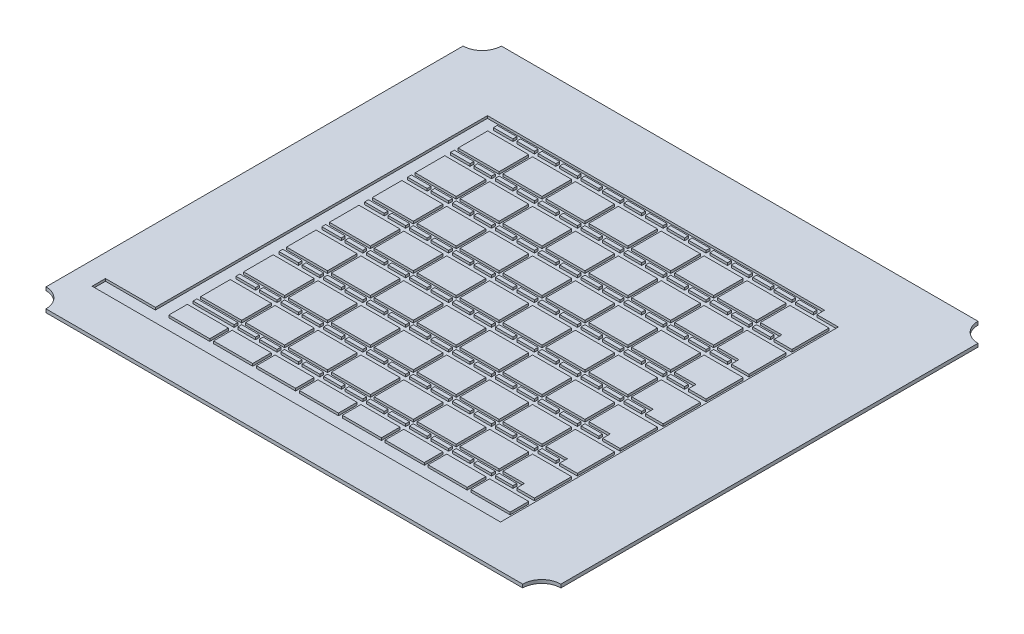
from build123d import *

# Parameters (mm, degrees)
SKETCH1_W           = 685.8
SKETCH1_H           = 606.425
BOSS_EXTRUDE1_DEPTH = 4.4958
SKETCH3_W           = 54.61
SKETCH3_H           = 24.765
SKETCH3_H_2         = 39.37
SKETCH3_W_2         = 26.035
SKETCH3_H_3         = 5.08
SKETCH3_W_3         = 23.495
SKETCH3_W_4         = 52.07
CUT_EXTRUDE1_DEPTH  = 3.175
CUT_EXTRUDE2_DEPTH  = 458.753691819


with BuildPart() as part:
    # Sketch1 → Boss-Extrude1 (new body)
    with BuildSketch(Plane(origin=(0, 0, 0), x_dir=(1, 0, 0), z_dir=(0, 1, 0))):
        Rectangle(SKETCH1_W, SKETCH1_H)
    extrude(amount=BOSS_EXTRUDE1_DEPTH)

    # Sketch3 → Cut-Extrude1 (cut)
    with BuildSketch(Plane(origin=(0, 4.4958, 0), x_dir=(1, 0, 0), z_dir=(0, 1, 0))):
        Polygon((-246.407774439, 213.72946466), (-246.407774439, -228.6), (-312.907002617, -228.6), (-312.907002617, -246.38), (231.14, -246.38), (231.14, -228.86553534), (231.14, -32.65053534), (231.14, -25.03053534), (231.14, -19.95053534), (231.14, -14.87053534), (231.14, 203.56946466), (226.06, 203.56946466), (202.565, 203.56946466), (202.565, 208.64946466), (202.565, 213.72946466), (173.99, 213.72946466), (168.91, 213.72946466), (116.84, 213.72946466), (111.76, 213.72946466), (59.69, 213.72946466), (54.61, 213.72946466), (2.54, 213.72946466), (-2.54, 213.72946466), (-54.61, 213.72946466), (-59.69, 213.72946466), (-111.76, 213.72946466), (-116.84, 213.72946466), (-168.91, 213.72946466), align=None)
        with Locations((-201.295, -216.2175)):
            Rectangle(SKETCH3_W, SKETCH3_H, mode=Mode.SUBTRACT)
        Polygon((-228.6, -196.215), (-228.6, -191.135), (-202.565, -191.135), (-197.485, -191.135), (-173.99, -191.135), (-173.99, -196.215), (-197.485, -196.215), (-202.565, -196.215), align=None, mode=Mode.SUBTRACT)
        with Locations((-201.295, -166.37)):
            Rectangle(SKETCH3_W, SKETCH3_H_2, mode=Mode.SUBTRACT)
        with Locations((-215.5825, -136.525)):
            Rectangle(SKETCH3_W_2, SKETCH3_H_3, mode=Mode.SUBTRACT)
        with Locations((-185.7375, -136.525)):
            Rectangle(SKETCH3_W_3, SKETCH3_H_3, mode=Mode.SUBTRACT)
        with Locations((-157.1625, -193.675)):
            Rectangle(SKETCH3_W_3, SKETCH3_H_3, mode=Mode.SUBTRACT)
        with Locations((-142.875, -216.2175)):
            Rectangle(SKETCH3_W_4, SKETCH3_H, mode=Mode.SUBTRACT)
        with Locations((-128.5875, -193.675)):
            Rectangle(SKETCH3_W_3, SKETCH3_H_3, mode=Mode.SUBTRACT)
        with Locations((-85.725, -216.2175)):
            Rectangle(SKETCH3_W_4, SKETCH3_H, mode=Mode.SUBTRACT)
        with Locations((-100.0125, -193.675)):
            Rectangle(SKETCH3_W_3, SKETCH3_H_3, mode=Mode.SUBTRACT)
        with Locations((-71.4375, -193.675)):
            Rectangle(SKETCH3_W_3, SKETCH3_H_3, mode=Mode.SUBTRACT)
        with Locations((-42.8625, -193.675)):
            Rectangle(SKETCH3_W_3, SKETCH3_H_3, mode=Mode.SUBTRACT)
        with Locations((-142.875, -166.37)):
            Rectangle(SKETCH3_W_4, SKETCH3_H_2, mode=Mode.SUBTRACT)
        with Locations((-157.1625, -136.525)):
            Rectangle(SKETCH3_W_3, SKETCH3_H_3, mode=Mode.SUBTRACT)
        with Locations((-128.5875, -136.525)):
            Rectangle(SKETCH3_W_3, SKETCH3_H_3, mode=Mode.SUBTRACT)
        with Locations((-85.725, -166.37)):
            Rectangle(SKETCH3_W_4, SKETCH3_H_2, mode=Mode.SUBTRACT)
        with Locations((-100.0125, -136.525)):
            Rectangle(SKETCH3_W_3, SKETCH3_H_3, mode=Mode.SUBTRACT)
        with Locations((-71.4375, -136.525)):
            Rectangle(SKETCH3_W_3, SKETCH3_H_3, mode=Mode.SUBTRACT)
        with Locations((-42.8625, -136.525)):
            Rectangle(SKETCH3_W_3, SKETCH3_H_3, mode=Mode.SUBTRACT)
        with Locations((-201.295, -109.22)):
            Rectangle(SKETCH3_W, SKETCH3_H_2, mode=Mode.SUBTRACT)
        with Locations((-215.5825, -79.375)):
            Rectangle(SKETCH3_W_2, SKETCH3_H_3, mode=Mode.SUBTRACT)
        with Locations((-185.7375, -79.375)):
            Rectangle(SKETCH3_W_3, SKETCH3_H_3, mode=Mode.SUBTRACT)
        with Locations((-201.295, -52.07)):
            Rectangle(SKETCH3_W, SKETCH3_H_2, mode=Mode.SUBTRACT)
        with Locations((-215.5825, -22.225)):
            Rectangle(SKETCH3_W_2, SKETCH3_H_3, mode=Mode.SUBTRACT)
        with Locations((-185.7375, -22.225)):
            Rectangle(SKETCH3_W_3, SKETCH3_H_3, mode=Mode.SUBTRACT)
        with Locations((-142.875, -109.22)):
            Rectangle(SKETCH3_W_4, SKETCH3_H_2, mode=Mode.SUBTRACT)
        with Locations((-157.1625, -79.375)):
            Rectangle(SKETCH3_W_3, SKETCH3_H_3, mode=Mode.SUBTRACT)
        with Locations((-128.5875, -79.375)):
            Rectangle(SKETCH3_W_3, SKETCH3_H_3, mode=Mode.SUBTRACT)
        with Locations((-85.725, -109.22)):
            Rectangle(SKETCH3_W_4, SKETCH3_H_2, mode=Mode.SUBTRACT)
        with Locations((-100.0125, -79.375)):
            Rectangle(SKETCH3_W_3, SKETCH3_H_3, mode=Mode.SUBTRACT)
        with Locations((-71.4375, -79.375)):
            Rectangle(SKETCH3_W_3, SKETCH3_H_3, mode=Mode.SUBTRACT)
        with Locations((-42.8625, -79.375)):
            Rectangle(SKETCH3_W_3, SKETCH3_H_3, mode=Mode.SUBTRACT)
        with Locations((-142.875, -52.07)):
            Rectangle(SKETCH3_W_4, SKETCH3_H_2, mode=Mode.SUBTRACT)
        with Locations((-157.1625, -22.225)):
            Rectangle(SKETCH3_W_3, SKETCH3_H_3, mode=Mode.SUBTRACT)
        with Locations((-128.5875, -22.225)):
            Rectangle(SKETCH3_W_3, SKETCH3_H_3, mode=Mode.SUBTRACT)
        with Locations((-85.725, -52.07)):
            Rectangle(SKETCH3_W_4, SKETCH3_H_2, mode=Mode.SUBTRACT)
        with Locations((-100.0125, -22.225)):
            Rectangle(SKETCH3_W_3, SKETCH3_H_3, mode=Mode.SUBTRACT)
        with Locations((-71.4375, -22.225)):
            Rectangle(SKETCH3_W_3, SKETCH3_H_3, mode=Mode.SUBTRACT)
        with Locations((-42.8625, -22.225)):
            Rectangle(SKETCH3_W_3, SKETCH3_H_3, mode=Mode.SUBTRACT)
        with Locations((-28.575, -216.2175)):
            Rectangle(SKETCH3_W_4, SKETCH3_H, mode=Mode.SUBTRACT)
        with Locations((-14.2875, -193.675)):
            Rectangle(SKETCH3_W_3, SKETCH3_H_3, mode=Mode.SUBTRACT)
        with Locations((14.2875, -193.675)):
            Rectangle(SKETCH3_W_3, SKETCH3_H_3, mode=Mode.SUBTRACT)
        with Locations((28.575, -216.2175)):
            Rectangle(SKETCH3_W_4, SKETCH3_H, mode=Mode.SUBTRACT)
        with Locations((42.8625, -193.675)):
            Rectangle(SKETCH3_W_3, SKETCH3_H_3, mode=Mode.SUBTRACT)
        with Locations((85.725, -216.2175)):
            Rectangle(SKETCH3_W_4, SKETCH3_H, mode=Mode.SUBTRACT)
        with Locations((71.4375, -193.675)):
            Rectangle(SKETCH3_W_3, SKETCH3_H_3, mode=Mode.SUBTRACT)
        with Locations((-28.575, -166.37)):
            Rectangle(SKETCH3_W_4, SKETCH3_H_2, mode=Mode.SUBTRACT)
        with Locations((-14.2875, -136.525)):
            Rectangle(SKETCH3_W_3, SKETCH3_H_3, mode=Mode.SUBTRACT)
        with Locations((14.2875, -136.525)):
            Rectangle(SKETCH3_W_3, SKETCH3_H_3, mode=Mode.SUBTRACT)
        with Locations((28.575, -166.37)):
            Rectangle(SKETCH3_W_4, SKETCH3_H_2, mode=Mode.SUBTRACT)
        with Locations((85.725, -166.37)):
            Rectangle(SKETCH3_W_4, SKETCH3_H_2, mode=Mode.SUBTRACT)
        with Locations((42.8625, -136.525)):
            Rectangle(SKETCH3_W_3, SKETCH3_H_3, mode=Mode.SUBTRACT)
        with Locations((71.4375, -136.525)):
            Rectangle(SKETCH3_W_3, SKETCH3_H_3, mode=Mode.SUBTRACT)
        with Locations((100.0125, -193.675)):
            Rectangle(SKETCH3_W_3, SKETCH3_H_3, mode=Mode.SUBTRACT)
        with Locations((128.5875, -193.675)):
            Rectangle(SKETCH3_W_3, SKETCH3_H_3, mode=Mode.SUBTRACT)
        with Locations((142.875, -216.2175)):
            Rectangle(SKETCH3_W_4, SKETCH3_H, mode=Mode.SUBTRACT)
        with Locations((157.1625, -193.675)):
            Rectangle(SKETCH3_W_3, SKETCH3_H_3, mode=Mode.SUBTRACT)
        with Locations((185.7375, -193.675)):
            Rectangle(SKETCH3_W_3, SKETCH3_H_3, mode=Mode.SUBTRACT)
        with Locations((200.025, -216.2175)):
            Rectangle(SKETCH3_W_4, SKETCH3_H, mode=Mode.SUBTRACT)
        with Locations((142.875, -166.37)):
            Rectangle(SKETCH3_W_4, SKETCH3_H_2, mode=Mode.SUBTRACT)
        with Locations((100.0125, -136.525)):
            Rectangle(SKETCH3_W_3, SKETCH3_H_3, mode=Mode.SUBTRACT)
        with Locations((128.5875, -136.525)):
            Rectangle(SKETCH3_W_3, SKETCH3_H_3, mode=Mode.SUBTRACT)
        with Locations((157.1625, -136.525)):
            Rectangle(SKETCH3_W_3, SKETCH3_H_3, mode=Mode.SUBTRACT)
        Polygon((202.565, -196.215), (202.565, -191.135), (202.565, -186.055), (173.99, -186.055), (173.99, -146.685), (226.06, -146.685), (226.06, -186.055), (226.06, -191.135), (226.06, -196.215), align=None, mode=Mode.SUBTRACT)
        with Locations((185.7375, -136.525)):
            Rectangle(SKETCH3_W_3, SKETCH3_H_3, mode=Mode.SUBTRACT)
        with Locations((-28.575, -109.22)):
            Rectangle(SKETCH3_W_4, SKETCH3_H_2, mode=Mode.SUBTRACT)
        with Locations((-14.2875, -79.375)):
            Rectangle(SKETCH3_W_3, SKETCH3_H_3, mode=Mode.SUBTRACT)
        with Locations((14.2875, -79.375)):
            Rectangle(SKETCH3_W_3, SKETCH3_H_3, mode=Mode.SUBTRACT)
        with Locations((28.575, -109.22)):
            Rectangle(SKETCH3_W_4, SKETCH3_H_2, mode=Mode.SUBTRACT)
        with Locations((85.725, -109.22)):
            Rectangle(SKETCH3_W_4, SKETCH3_H_2, mode=Mode.SUBTRACT)
        with Locations((42.8625, -79.375)):
            Rectangle(SKETCH3_W_3, SKETCH3_H_3, mode=Mode.SUBTRACT)
        with Locations((71.4375, -79.375)):
            Rectangle(SKETCH3_W_3, SKETCH3_H_3, mode=Mode.SUBTRACT)
        with Locations((-28.575, -52.07)):
            Rectangle(SKETCH3_W_4, SKETCH3_H_2, mode=Mode.SUBTRACT)
        with Locations((-14.2875, -22.225)):
            Rectangle(SKETCH3_W_3, SKETCH3_H_3, mode=Mode.SUBTRACT)
        with Locations((14.2875, -22.225)):
            Rectangle(SKETCH3_W_3, SKETCH3_H_3, mode=Mode.SUBTRACT)
        with Locations((28.575, -52.07)):
            Rectangle(SKETCH3_W_4, SKETCH3_H_2, mode=Mode.SUBTRACT)
        with Locations((85.725, -52.07)):
            Rectangle(SKETCH3_W_4, SKETCH3_H_2, mode=Mode.SUBTRACT)
        with Locations((42.8625, -22.225)):
            Rectangle(SKETCH3_W_3, SKETCH3_H_3, mode=Mode.SUBTRACT)
        with Locations((71.4375, -22.225)):
            Rectangle(SKETCH3_W_3, SKETCH3_H_3, mode=Mode.SUBTRACT)
        with Locations((142.875, -109.22)):
            Rectangle(SKETCH3_W_4, SKETCH3_H_2, mode=Mode.SUBTRACT)
        with Locations((100.0125, -79.375)):
            Rectangle(SKETCH3_W_3, SKETCH3_H_3, mode=Mode.SUBTRACT)
        with Locations((128.5875, -79.375)):
            Rectangle(SKETCH3_W_3, SKETCH3_H_3, mode=Mode.SUBTRACT)
        with Locations((157.1625, -79.375)):
            Rectangle(SKETCH3_W_3, SKETCH3_H_3, mode=Mode.SUBTRACT)
        Polygon((226.06, -128.905), (226.06, -133.985), (226.06, -139.065), (202.565, -139.065), (202.565, -133.985), (202.565, -128.905), (173.99, -128.905), (173.99, -89.535), (226.06, -89.535), align=None, mode=Mode.SUBTRACT)
        with Locations((185.7375, -79.375)):
            Rectangle(SKETCH3_W_3, SKETCH3_H_3, mode=Mode.SUBTRACT)
        with Locations((142.875, -52.07)):
            Rectangle(SKETCH3_W_4, SKETCH3_H_2, mode=Mode.SUBTRACT)
        with Locations((100.0125, -22.225)):
            Rectangle(SKETCH3_W_3, SKETCH3_H_3, mode=Mode.SUBTRACT)
        with Locations((128.5875, -22.225)):
            Rectangle(SKETCH3_W_3, SKETCH3_H_3, mode=Mode.SUBTRACT)
        with Locations((157.1625, -22.225)):
            Rectangle(SKETCH3_W_3, SKETCH3_H_3, mode=Mode.SUBTRACT)
        Polygon((202.565, -81.915), (202.565, -76.835), (202.565, -71.755), (173.99, -71.755), (173.99, -32.385), (226.06, -32.385), (226.06, -71.755), (226.06, -72.238596741), (226.06, -76.835), (226.06, -81.915), align=None, mode=Mode.SUBTRACT)
        with Locations((185.7375, -22.225)):
            Rectangle(SKETCH3_W_3, SKETCH3_H_3, mode=Mode.SUBTRACT)
        with Locations((-201.295, 5.08)):
            Rectangle(SKETCH3_W, SKETCH3_H_2, mode=Mode.SUBTRACT)
        with Locations((-215.5825, 34.925)):
            Rectangle(SKETCH3_W_2, SKETCH3_H_3, mode=Mode.SUBTRACT)
        with Locations((-185.7375, 34.925)):
            Rectangle(SKETCH3_W_3, SKETCH3_H_3, mode=Mode.SUBTRACT)
        with Locations((-201.295, 62.23)):
            Rectangle(SKETCH3_W, SKETCH3_H_2, mode=Mode.SUBTRACT)
        with Locations((-215.5825, 92.075)):
            Rectangle(SKETCH3_W_2, SKETCH3_H_3, mode=Mode.SUBTRACT)
        with Locations((-185.7375, 92.075)):
            Rectangle(SKETCH3_W_3, SKETCH3_H_3, mode=Mode.SUBTRACT)
        with Locations((-142.875, 5.08)):
            Rectangle(SKETCH3_W_4, SKETCH3_H_2, mode=Mode.SUBTRACT)
        with Locations((-157.1625, 34.925)):
            Rectangle(SKETCH3_W_3, SKETCH3_H_3, mode=Mode.SUBTRACT)
        with Locations((-128.5875, 34.925)):
            Rectangle(SKETCH3_W_3, SKETCH3_H_3, mode=Mode.SUBTRACT)
        with Locations((-85.725, 5.08)):
            Rectangle(SKETCH3_W_4, SKETCH3_H_2, mode=Mode.SUBTRACT)
        with Locations((-100.0125, 34.925)):
            Rectangle(SKETCH3_W_3, SKETCH3_H_3, mode=Mode.SUBTRACT)
        with Locations((-71.4375, 34.925)):
            Rectangle(SKETCH3_W_3, SKETCH3_H_3, mode=Mode.SUBTRACT)
        with Locations((-42.8625, 34.925)):
            Rectangle(SKETCH3_W_3, SKETCH3_H_3, mode=Mode.SUBTRACT)
        with Locations((-142.875, 62.23)):
            Rectangle(SKETCH3_W_4, SKETCH3_H_2, mode=Mode.SUBTRACT)
        with Locations((-157.1625, 92.075)):
            Rectangle(SKETCH3_W_3, SKETCH3_H_3, mode=Mode.SUBTRACT)
        with Locations((-128.5875, 92.075)):
            Rectangle(SKETCH3_W_3, SKETCH3_H_3, mode=Mode.SUBTRACT)
        with Locations((-85.725, 62.23)):
            Rectangle(SKETCH3_W_4, SKETCH3_H_2, mode=Mode.SUBTRACT)
        with Locations((-100.0125, 92.075)):
            Rectangle(SKETCH3_W_3, SKETCH3_H_3, mode=Mode.SUBTRACT)
        with Locations((-71.4375, 92.075)):
            Rectangle(SKETCH3_W_3, SKETCH3_H_3, mode=Mode.SUBTRACT)
        with Locations((-42.8625, 92.075)):
            Rectangle(SKETCH3_W_3, SKETCH3_H_3, mode=Mode.SUBTRACT)
        with Locations((-201.295, 119.38)):
            Rectangle(SKETCH3_W, SKETCH3_H_2, mode=Mode.SUBTRACT)
        with Locations((-215.5825, 149.225)):
            Rectangle(SKETCH3_W_2, SKETCH3_H_3, mode=Mode.SUBTRACT)
        with Locations((-185.7375, 149.225)):
            Rectangle(SKETCH3_W_3, SKETCH3_H_3, mode=Mode.SUBTRACT)
        with Locations((-201.295, 176.53)):
            Rectangle(SKETCH3_W, SKETCH3_H_2, mode=Mode.SUBTRACT)
        with Locations((-215.5825, 206.375)):
            Rectangle(SKETCH3_W_2, SKETCH3_H_3, mode=Mode.SUBTRACT)
        with Locations((-185.7375, 206.375)):
            Rectangle(SKETCH3_W_3, SKETCH3_H_3, mode=Mode.SUBTRACT)
        with Locations((-142.875, 119.38)):
            Rectangle(SKETCH3_W_4, SKETCH3_H_2, mode=Mode.SUBTRACT)
        with Locations((-157.1625, 149.225)):
            Rectangle(SKETCH3_W_3, SKETCH3_H_3, mode=Mode.SUBTRACT)
        with Locations((-128.5875, 149.225)):
            Rectangle(SKETCH3_W_3, SKETCH3_H_3, mode=Mode.SUBTRACT)
        with Locations((-85.725, 119.38)):
            Rectangle(SKETCH3_W_4, SKETCH3_H_2, mode=Mode.SUBTRACT)
        with Locations((-100.0125, 149.225)):
            Rectangle(SKETCH3_W_3, SKETCH3_H_3, mode=Mode.SUBTRACT)
        with Locations((-71.4375, 149.225)):
            Rectangle(SKETCH3_W_3, SKETCH3_H_3, mode=Mode.SUBTRACT)
        with Locations((-42.8625, 149.225)):
            Rectangle(SKETCH3_W_3, SKETCH3_H_3, mode=Mode.SUBTRACT)
        with Locations((-142.875, 176.53)):
            Rectangle(SKETCH3_W_4, SKETCH3_H_2, mode=Mode.SUBTRACT)
        with Locations((-157.1625, 206.375)):
            Rectangle(SKETCH3_W_3, SKETCH3_H_3, mode=Mode.SUBTRACT)
        with Locations((-128.5875, 206.375)):
            Rectangle(SKETCH3_W_3, SKETCH3_H_3, mode=Mode.SUBTRACT)
        with Locations((-85.725, 176.53)):
            Rectangle(SKETCH3_W_4, SKETCH3_H_2, mode=Mode.SUBTRACT)
        with Locations((-100.0125, 206.375)):
            Rectangle(SKETCH3_W_3, SKETCH3_H_3, mode=Mode.SUBTRACT)
        with Locations((-71.4375, 206.375)):
            Rectangle(SKETCH3_W_3, SKETCH3_H_3, mode=Mode.SUBTRACT)
        with Locations((-42.8625, 206.375)):
            Rectangle(SKETCH3_W_3, SKETCH3_H_3, mode=Mode.SUBTRACT)
        with Locations((-28.575, 5.08)):
            Rectangle(SKETCH3_W_4, SKETCH3_H_2, mode=Mode.SUBTRACT)
        with Locations((-14.2875, 34.925)):
            Rectangle(SKETCH3_W_3, SKETCH3_H_3, mode=Mode.SUBTRACT)
        with Locations((14.2875, 34.925)):
            Rectangle(SKETCH3_W_3, SKETCH3_H_3, mode=Mode.SUBTRACT)
        with Locations((28.575, 5.08)):
            Rectangle(SKETCH3_W_4, SKETCH3_H_2, mode=Mode.SUBTRACT)
        with Locations((85.725, 5.08)):
            Rectangle(SKETCH3_W_4, SKETCH3_H_2, mode=Mode.SUBTRACT)
        with Locations((42.8625, 34.925)):
            Rectangle(SKETCH3_W_3, SKETCH3_H_3, mode=Mode.SUBTRACT)
        with Locations((71.4375, 34.925)):
            Rectangle(SKETCH3_W_3, SKETCH3_H_3, mode=Mode.SUBTRACT)
        with Locations((-28.575, 62.23)):
            Rectangle(SKETCH3_W_4, SKETCH3_H_2, mode=Mode.SUBTRACT)
        with Locations((-14.2875, 92.075)):
            Rectangle(SKETCH3_W_3, SKETCH3_H_3, mode=Mode.SUBTRACT)
        with Locations((14.2875, 92.075)):
            Rectangle(SKETCH3_W_3, SKETCH3_H_3, mode=Mode.SUBTRACT)
        with Locations((28.575, 62.23)):
            Rectangle(SKETCH3_W_4, SKETCH3_H_2, mode=Mode.SUBTRACT)
        with Locations((85.725, 62.23)):
            Rectangle(SKETCH3_W_4, SKETCH3_H_2, mode=Mode.SUBTRACT)
        with Locations((42.8625, 92.075)):
            Rectangle(SKETCH3_W_3, SKETCH3_H_3, mode=Mode.SUBTRACT)
        with Locations((71.4375, 92.075)):
            Rectangle(SKETCH3_W_3, SKETCH3_H_3, mode=Mode.SUBTRACT)
        with Locations((142.875, 5.08)):
            Rectangle(SKETCH3_W_4, SKETCH3_H_2, mode=Mode.SUBTRACT)
        with Locations((100.0125, 34.925)):
            Rectangle(SKETCH3_W_3, SKETCH3_H_3, mode=Mode.SUBTRACT)
        with Locations((128.5875, 34.925)):
            Rectangle(SKETCH3_W_3, SKETCH3_H_3, mode=Mode.SUBTRACT)
        with Locations((157.1625, 34.925)):
            Rectangle(SKETCH3_W_3, SKETCH3_H_3, mode=Mode.SUBTRACT)
        Polygon((202.565, -24.765), (202.565, -19.685), (202.565, -14.605), (173.99, -14.605), (173.99, 24.765), (226.06, 24.765), (226.06, -14.605), (226.06, -19.685), (226.06, -24.765), align=None, mode=Mode.SUBTRACT)
        with Locations((185.7375, 34.925)):
            Rectangle(SKETCH3_W_3, SKETCH3_H_3, mode=Mode.SUBTRACT)
        with Locations((142.875, 62.23)):
            Rectangle(SKETCH3_W_4, SKETCH3_H_2, mode=Mode.SUBTRACT)
        with Locations((100.0125, 92.075)):
            Rectangle(SKETCH3_W_3, SKETCH3_H_3, mode=Mode.SUBTRACT)
        with Locations((128.5875, 92.075)):
            Rectangle(SKETCH3_W_3, SKETCH3_H_3, mode=Mode.SUBTRACT)
        with Locations((157.1625, 92.075)):
            Rectangle(SKETCH3_W_3, SKETCH3_H_3, mode=Mode.SUBTRACT)
        Polygon((226.06, 42.545), (226.06, 37.465), (226.06, 32.385), (202.565, 32.385), (202.565, 37.465), (202.565, 42.545), (173.99, 42.545), (173.99, 81.915), (226.06, 81.915), align=None, mode=Mode.SUBTRACT)
        with Locations((185.7375, 92.075)):
            Rectangle(SKETCH3_W_3, SKETCH3_H_3, mode=Mode.SUBTRACT)
        with Locations((-28.575, 119.38)):
            Rectangle(SKETCH3_W_4, SKETCH3_H_2, mode=Mode.SUBTRACT)
        with Locations((-14.2875, 149.225)):
            Rectangle(SKETCH3_W_3, SKETCH3_H_3, mode=Mode.SUBTRACT)
        with Locations((14.2875, 149.225)):
            Rectangle(SKETCH3_W_3, SKETCH3_H_3, mode=Mode.SUBTRACT)
        with Locations((28.575, 119.38)):
            Rectangle(SKETCH3_W_4, SKETCH3_H_2, mode=Mode.SUBTRACT)
        with Locations((85.725, 119.38)):
            Rectangle(SKETCH3_W_4, SKETCH3_H_2, mode=Mode.SUBTRACT)
        with Locations((42.8625, 149.225)):
            Rectangle(SKETCH3_W_3, SKETCH3_H_3, mode=Mode.SUBTRACT)
        with Locations((71.4375, 149.225)):
            Rectangle(SKETCH3_W_3, SKETCH3_H_3, mode=Mode.SUBTRACT)
        with Locations((-28.575, 176.53)):
            Rectangle(SKETCH3_W_4, SKETCH3_H_2, mode=Mode.SUBTRACT)
        with Locations((-14.2875, 206.375)):
            Rectangle(SKETCH3_W_3, SKETCH3_H_3, mode=Mode.SUBTRACT)
        with Locations((14.2875, 206.375)):
            Rectangle(SKETCH3_W_3, SKETCH3_H_3, mode=Mode.SUBTRACT)
        with Locations((28.575, 176.53)):
            Rectangle(SKETCH3_W_4, SKETCH3_H_2, mode=Mode.SUBTRACT)
        with Locations((85.725, 176.53)):
            Rectangle(SKETCH3_W_4, SKETCH3_H_2, mode=Mode.SUBTRACT)
        with Locations((42.8625, 206.375)):
            Rectangle(SKETCH3_W_3, SKETCH3_H_3, mode=Mode.SUBTRACT)
        with Locations((71.4375, 206.375)):
            Rectangle(SKETCH3_W_3, SKETCH3_H_3, mode=Mode.SUBTRACT)
        with Locations((142.875, 119.38)):
            Rectangle(SKETCH3_W_4, SKETCH3_H_2, mode=Mode.SUBTRACT)
        with Locations((100.0125, 149.225)):
            Rectangle(SKETCH3_W_3, SKETCH3_H_3, mode=Mode.SUBTRACT)
        with Locations((128.5875, 149.225)):
            Rectangle(SKETCH3_W_3, SKETCH3_H_3, mode=Mode.SUBTRACT)
        with Locations((157.1625, 149.225)):
            Rectangle(SKETCH3_W_3, SKETCH3_H_3, mode=Mode.SUBTRACT)
        Polygon((226.06, 89.535), (202.565, 89.535), (202.565, 94.615), (202.565, 99.695), (173.99, 99.695), (173.99, 139.065), (226.06, 139.065), (226.06, 99.695), (226.06, 94.615), align=None, mode=Mode.SUBTRACT)
        with Locations((185.7375, 149.225)):
            Rectangle(SKETCH3_W_3, SKETCH3_H_3, mode=Mode.SUBTRACT)
        with Locations((142.875, 176.53)):
            Rectangle(SKETCH3_W_4, SKETCH3_H_2, mode=Mode.SUBTRACT)
        with Locations((100.0125, 206.375)):
            Rectangle(SKETCH3_W_3, SKETCH3_H_3, mode=Mode.SUBTRACT)
        with Locations((128.5875, 206.375)):
            Rectangle(SKETCH3_W_3, SKETCH3_H_3, mode=Mode.SUBTRACT)
        with Locations((157.1625, 206.375)):
            Rectangle(SKETCH3_W_3, SKETCH3_H_3, mode=Mode.SUBTRACT)
        Polygon((226.06, 146.685), (202.565, 146.685), (202.565, 151.765), (202.565, 156.845), (173.99, 156.845), (173.99, 196.215), (226.06, 196.215), (226.06, 156.845), (226.06, 151.765), align=None, mode=Mode.SUBTRACT)
        with Locations((185.7375, 206.375)):
            Rectangle(SKETCH3_W_3, SKETCH3_H_3, mode=Mode.SUBTRACT)
    extrude(amount=-CUT_EXTRUDE1_DEPTH, mode=Mode.SUBTRACT)

    # Sketch5 → Cut-Extrude2 (cut, through all)
    with BuildSketch(Plane.XZ):
        with BuildLine():
            Line((317.5, 303.2125), (342.9, 303.2125))
            Line((342.9, 303.2125), (342.9, 277.8125))
            ThreePointArc((342.9, 277.8125), (324.939487758, 285.251987758), (317.5, 303.2125))
        make_face()
        with BuildLine():
            Line((-317.5, 303.2125), (-342.9, 303.2125))
            Line((-342.9, 303.2125), (-342.9, 277.8125))
            ThreePointArc((-342.9, 277.8125), (-324.939487758, 285.251987758), (-317.5, 303.2125))
        make_face()
        with BuildLine():
            Line((-342.9, -303.2125), (-342.9, -277.8125))
            ThreePointArc((-342.9, -277.8125), (-324.939487758, -285.251987758), (-317.5, -303.2125))
            Line((-317.5, -303.2125), (-342.9, -303.2125))
        make_face()
        with BuildLine():
            Line((342.9, -303.2125), (342.9, -277.8125))
            ThreePointArc((342.9, -277.8125), (324.939487758, -285.251987758), (317.5, -303.2125))
            Line((317.5, -303.2125), (342.9, -303.2125))
        make_face()
    extrude(amount=-CUT_EXTRUDE2_DEPTH, mode=Mode.SUBTRACT)


solid = part.part
